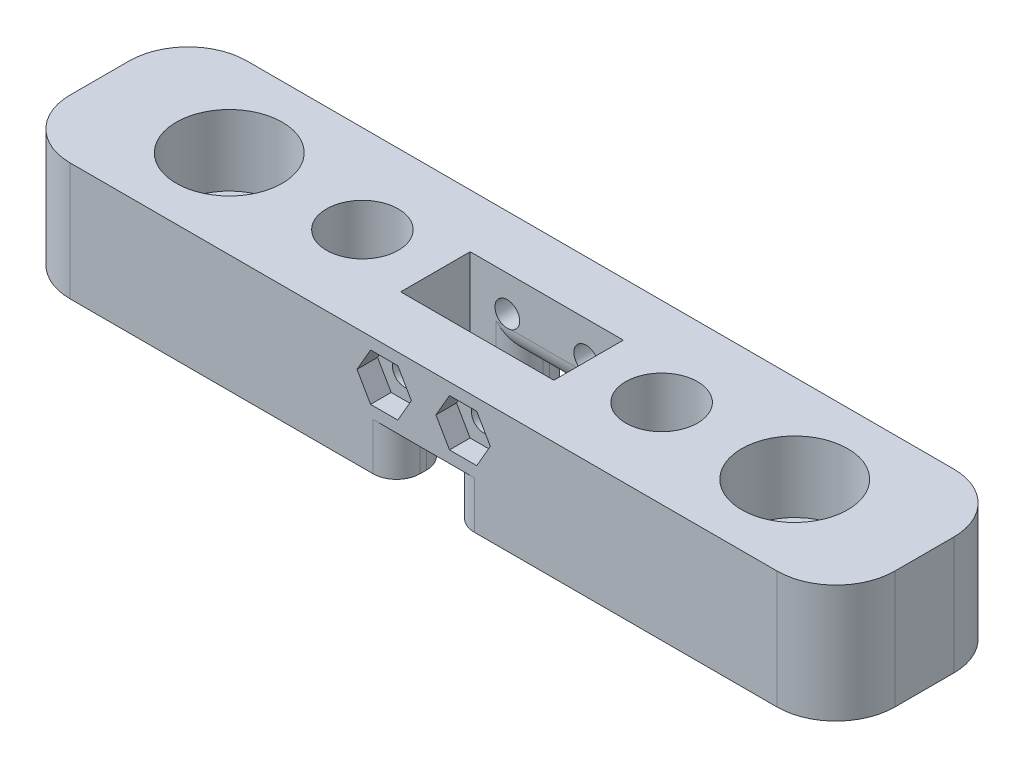
from build123d import *

# Parameters (mm, degrees)
SKETCH1_W                = 40
SKETCH1_H                = 10
SWITCHCASE_DEPTH         = 15
SKETCH2_W                = 13
SKETCH2_H                = 5.9
SWITCHCAVITY_DEPTH       = 44.874821937
SWITCHM2HOLES_DEPTH      = 43.534721111
SWITCHM2HOLES_DEPTH_BACK = 43.534721111
SKETCH3_R                = 1.05
SKETCH14_R               = 2
M2HEAD_DEPTH             = 1.5
M2NUTINSERTS_DEPTH       = 44.874821937
M2NUTINSERTS_DEPTH_BACK  = 1.75
SKETCH7_W                = 15
SKETCH7_H                = 10
WINGS_DEPTH              = 15
M5NUTS_DEPTH             = 4
SKETCH10_R               = 3.05
M6HOLE_DEPTH             = 58.879184514
WIRECHANNEL_DEPTH        = 57.870049235
WIRECHANNEL_DEPTH_BACK   = 57.870049235
SKETCH11_W               = 4.6
SKETCH11_H               = 4
CHANNELFILLET_R          = 2
M5HEAD_DEPTH             = 58.879184514
M5HEAD_DEPTH_BACK        = 6
SKETCH12_R               = 4.5
SKETCH13_R               = 2.75
M5THREAD_DEPTH           = 58.879184514
ENDFILLET_R              = 5


with BuildPart() as part:
    # Sketch1 → SwitchCase (new body)
    with BuildSketch(Plane.XY):
        with Locations((20, 5)):
            Rectangle(SKETCH1_W, SKETCH1_H)
    extrude(amount=SWITCHCASE_DEPTH)

    # Sketch2 → SwitchCavity (cut, through all)
    with BuildSketch(Plane(origin=(0, 10, 0), x_dir=(1, 0, 0), z_dir=(0, 1, 0))):
        with Locations((20, -7.5)):
            Rectangle(SKETCH2_W, SKETCH2_H)
    extrude(amount=-SWITCHCAVITY_DEPTH, mode=Mode.SUBTRACT)

    # Sketch3 → SwitchM2Holes (cut, two sides: drawn at the far end of the back side and taken through both)
    with BuildSketch(Plane.XY.offset(4.55).offset(-SWITCHM2HOLES_DEPTH_BACK)):
        with Locations((16.65, 7)):
            Circle(SKETCH3_R)
        with Locations((23.35, 7)):
            Circle(SKETCH3_R)
    extrude(amount=SWITCHM2HOLES_DEPTH + SWITCHM2HOLES_DEPTH_BACK, mode=Mode.SUBTRACT)

    # Sketch14 → M2Head (cut)
    with BuildSketch(Plane(origin=(0, 0, 0), x_dir=(-1, 0, 0), z_dir=(0, 0, -1))):
        with Locations((-23.35, 7)):
            Circle(SKETCH14_R)
        with Locations(Location((-16.65, 7, 0), (0, 0, 180))):
            Circle(SKETCH14_R)
    extrude(amount=-M2HEAD_DEPTH, mode=Mode.SUBTRACT)

    # Sketch5 → M2NutInserts (cut, two sides: drawn at the far end of the back side and taken through both)
    with BuildSketch(Plane.XY.offset(15).offset(-M2NUTINSERTS_DEPTH_BACK)):
        Polygon((18.959401077, 7), (17.804700538, 9), (15.495299462, 9), (14.340598923, 7), (15.495299462, 5), (17.804700538, 5), align=None)
        Polygon((25.659401077, 7), (24.504700538, 9), (22.195299462, 9), (21.040598923, 7), (22.195299462, 5), (24.504700538, 5), align=None)
    extrude(amount=M2NUTINSERTS_DEPTH + M2NUTINSERTS_DEPTH_BACK, mode=Mode.SUBTRACT)

    # Sketch7 → Wings (add)
    with BuildSketch(Plane.XY.offset(15)):
        with Locations((-7.5, 5)):
            Rectangle(SKETCH7_W, SKETCH7_H)
        with Locations((47.5, 5)):
            Rectangle(SKETCH7_W, SKETCH7_H)
    extrude(amount=-WINGS_DEPTH)

    # Sketch9 → M5Nuts (cut)
    with BuildSketch(Plane.XZ):
        Polygon((37.232199613, 7.5), (34.966099807, 11.425), (30.433900193, 11.425), (28.167800387, 7.5), (30.433900193, 3.575), (34.966099807, 3.575), align=None)
        Polygon((5.033900193, 3.575), (2.767800387, 7.5), (5.033900193, 11.425), (9.566099807, 11.425), (11.832199613, 7.5), (9.566099807, 3.575), align=None)
    extrude(amount=-M5NUTS_DEPTH, mode=Mode.SUBTRACT)

    # Sketch10 → M6Hole (cut, through all)
    with BuildSketch(Plane.XZ):
        with Locations(Location((7.3, 7.5, 0), (0, 0, 270))):
            Circle(SKETCH10_R)
        with Locations(Location((32.7, 7.5, 0), (0, 0, 270))):
            Circle(SKETCH10_R)
    extrude(amount=-M6HOLE_DEPTH, mode=Mode.SUBTRACT)

    # Sketch11 → WireChannel (cut, two sides: drawn at the far end of the back side and taken through both)
    with BuildSketch(Plane.XY.offset(4.55).offset(-WIRECHANNEL_DEPTH_BACK)):
        with Locations((20, 2)):
            Rectangle(SKETCH11_W, SKETCH11_H)
    extrude(amount=WIRECHANNEL_DEPTH + WIRECHANNEL_DEPTH_BACK, mode=Mode.SUBTRACT)

    # ChannelFillet
    # the kernel refuses this fillet: 2 mm, written as the material it takes off along each edge
    with BuildSketch(Plane(origin=(22.3, 4, 10.45), x_dir=(0, 1, 0), z_dir=(-1, 0, 0)), Plane(origin=(17.7, 4, 4.55), x_dir=(0, 1, 0), z_dir=(1, 0, 0))) as channelfillet_piece_1:
        with BuildLine():
            CenterArc((CHANNELFILLET_R, -CHANNELFILLET_R), CHANNELFILLET_R, 90, 90)
            Line((0, -CHANNELFILLET_R), (-CHANNELFILLET_R * 0.02, -CHANNELFILLET_R))
            Line((-CHANNELFILLET_R * 0.02, -CHANNELFILLET_R), (-CHANNELFILLET_R * 0.02, CHANNELFILLET_R * 0.02))
            Line((-CHANNELFILLET_R * 0.02, CHANNELFILLET_R * 0.02), (CHANNELFILLET_R, CHANNELFILLET_R * 0.02))
            Line((CHANNELFILLET_R, CHANNELFILLET_R * 0.02), (CHANNELFILLET_R, 0))
        make_face()
    extrude(amount=4.6, mode=Mode.SUBTRACT)
    with BuildSketch(Plane(origin=(17.7, 4, 10.45), x_dir=(-1, 0, 0), z_dir=(0, -1, 0)), Plane(origin=(22.3, 0, 10.45), x_dir=(1, 0, 0), z_dir=(0, 1, 0)), Plane(origin=(22.3, 4, 4.55), x_dir=(1, 0, 0), z_dir=(0, -1, 0)), Plane(origin=(22.3, 4, 15), x_dir=(1, 0, 0), z_dir=(0, -1, 0))) as channelfillet_piece_2:
        with BuildLine():
            CenterArc((CHANNELFILLET_R, -CHANNELFILLET_R), CHANNELFILLET_R, 90, 90)
            Line((0, -CHANNELFILLET_R), (-CHANNELFILLET_R * 0.02, -CHANNELFILLET_R))
            Line((-CHANNELFILLET_R * 0.02, -CHANNELFILLET_R), (-CHANNELFILLET_R * 0.02, CHANNELFILLET_R * 0.02))
            Line((-CHANNELFILLET_R * 0.02, CHANNELFILLET_R * 0.02), (CHANNELFILLET_R, CHANNELFILLET_R * 0.02))
            Line((CHANNELFILLET_R, CHANNELFILLET_R * 0.02), (CHANNELFILLET_R, 0))
        make_face()
    extrude(amount=4, mode=Mode.SUBTRACT)
    with BuildSketch(Plane(origin=(22.3, 4, 0), x_dir=(1, 0, 0), z_dir=(0, -1, 0)), Plane(origin=(17.7, 0, 4.55), x_dir=(0, 0, -1), z_dir=(0, 1, 0)), Plane(origin=(17.7, 0, 0), x_dir=(-1, 0, 0), z_dir=(0, 1, 0)), Plane(origin=(17.7, 0, 15), x_dir=(0, 0, -1), z_dir=(0, 1, 0))) as channelfillet_piece_3:
        with BuildLine():
            CenterArc((CHANNELFILLET_R, CHANNELFILLET_R), CHANNELFILLET_R, 180, 90)
            Line((0, CHANNELFILLET_R), (-CHANNELFILLET_R * 0.02, CHANNELFILLET_R))
            Line((-CHANNELFILLET_R * 0.02, CHANNELFILLET_R), (-CHANNELFILLET_R * 0.02, -CHANNELFILLET_R * 0.02))
            Line((-CHANNELFILLET_R * 0.02, -CHANNELFILLET_R * 0.02), (CHANNELFILLET_R, -CHANNELFILLET_R * 0.02))
            Line((CHANNELFILLET_R, -CHANNELFILLET_R * 0.02), (CHANNELFILLET_R, 0))
        make_face()
    extrude(amount=4, mode=Mode.SUBTRACT)
    with BuildSketch(Plane(origin=(27.3, 4, 10.45), x_dir=(0, 1, 0), z_dir=(-1, 0, 0))) as channelfillet_piece_4a_section:
        with BuildLine():
            CenterArc((CHANNELFILLET_R, -CHANNELFILLET_R), CHANNELFILLET_R, 90, 90)
            Line((0, -CHANNELFILLET_R), (-CHANNELFILLET_R * 0.02, -CHANNELFILLET_R))
            Line((-CHANNELFILLET_R * 0.02, -CHANNELFILLET_R), (-CHANNELFILLET_R * 0.02, CHANNELFILLET_R * 0.02))
            Line((-CHANNELFILLET_R * 0.02, CHANNELFILLET_R * 0.02), (CHANNELFILLET_R, CHANNELFILLET_R * 0.02))
            Line((CHANNELFILLET_R, CHANNELFILLET_R * 0.02), (CHANNELFILLET_R, 0))
        make_face()
    channelfillet_piece_4a = extrude(amount=9.6, mode=Mode.PRIVATE)
    channelfillet_piece_4a = split(channelfillet_piece_4a, bisect_by=Plane(origin=(22.3, 4.452790229, 10.902790229), z_dir=(1, 0, 0)), keep=Keep.TOP, mode=Mode.PRIVATE)
    with BuildSketch(Plane(origin=(22.3, 0, 10.45), x_dir=(1, 0, 0), z_dir=(0, 1, 0))) as channelfillet_piece_4b_section:
        with BuildLine():
            CenterArc((CHANNELFILLET_R, -CHANNELFILLET_R), CHANNELFILLET_R, 90, 90)
            Line((0, -CHANNELFILLET_R), (-CHANNELFILLET_R * 0.02, -CHANNELFILLET_R))
            Line((-CHANNELFILLET_R * 0.02, -CHANNELFILLET_R), (-CHANNELFILLET_R * 0.02, CHANNELFILLET_R * 0.02))
            Line((-CHANNELFILLET_R * 0.02, CHANNELFILLET_R * 0.02), (CHANNELFILLET_R, CHANNELFILLET_R * 0.02))
            Line((CHANNELFILLET_R, CHANNELFILLET_R * 0.02), (CHANNELFILLET_R, 0))
        make_face()
    channelfillet_piece_4b = extrude(amount=9, mode=Mode.PRIVATE)
    channelfillet_piece_4b = split(channelfillet_piece_4b, bisect_by=Plane(origin=(22.752790229, 4, 10.902790229), z_dir=(0, 1, 0)), keep=Keep.TOP, mode=Mode.PRIVATE)
    channelfillet_piece_4 = channelfillet_piece_4a & channelfillet_piece_4b
    add(channelfillet_piece_4, mode=Mode.SUBTRACT)
    with BuildSketch(Plane(origin=(17.7, 9, 10.45), x_dir=(-1, 0, 0), z_dir=(0, -1, 0))) as channelfillet_piece_5a_section:
        with BuildLine():
            CenterArc((CHANNELFILLET_R, -CHANNELFILLET_R), CHANNELFILLET_R, 90, 90)
            Line((0, -CHANNELFILLET_R), (-CHANNELFILLET_R * 0.02, -CHANNELFILLET_R))
            Line((-CHANNELFILLET_R * 0.02, -CHANNELFILLET_R), (-CHANNELFILLET_R * 0.02, CHANNELFILLET_R * 0.02))
            Line((-CHANNELFILLET_R * 0.02, CHANNELFILLET_R * 0.02), (CHANNELFILLET_R, CHANNELFILLET_R * 0.02))
            Line((CHANNELFILLET_R, CHANNELFILLET_R * 0.02), (CHANNELFILLET_R, 0))
        make_face()
    channelfillet_piece_5a = extrude(amount=9, mode=Mode.PRIVATE)
    channelfillet_piece_5a = split(channelfillet_piece_5a, bisect_by=Plane(origin=(17.247209771, 4, 10.902790229), z_dir=(0, 1, 0)), keep=Keep.TOP, mode=Mode.PRIVATE)
    with BuildSketch(Plane(origin=(22.3, 4, 10.45), x_dir=(0, 1, 0), z_dir=(-1, 0, 0))) as channelfillet_piece_5b_section:
        with BuildLine():
            CenterArc((CHANNELFILLET_R, -CHANNELFILLET_R), CHANNELFILLET_R, 90, 90)
            Line((0, -CHANNELFILLET_R), (-CHANNELFILLET_R * 0.02, -CHANNELFILLET_R))
            Line((-CHANNELFILLET_R * 0.02, -CHANNELFILLET_R), (-CHANNELFILLET_R * 0.02, CHANNELFILLET_R * 0.02))
            Line((-CHANNELFILLET_R * 0.02, CHANNELFILLET_R * 0.02), (CHANNELFILLET_R, CHANNELFILLET_R * 0.02))
            Line((CHANNELFILLET_R, CHANNELFILLET_R * 0.02), (CHANNELFILLET_R, 0))
        make_face()
    channelfillet_piece_5b = extrude(amount=9.6, mode=Mode.PRIVATE)
    channelfillet_piece_5b = split(channelfillet_piece_5b, bisect_by=Plane(origin=(17.7, 4.452790229, 10.902790229), z_dir=(-1, 0, 0)), keep=Keep.TOP, mode=Mode.PRIVATE)
    channelfillet_piece_5 = channelfillet_piece_5a & channelfillet_piece_5b
    add(channelfillet_piece_5, mode=Mode.SUBTRACT)
    with BuildSketch(Plane(origin=(22.3, 9, 4.55), x_dir=(1, 0, 0), z_dir=(0, -1, 0))) as channelfillet_piece_6a_section:
        with BuildLine():
            CenterArc((CHANNELFILLET_R, -CHANNELFILLET_R), CHANNELFILLET_R, 90, 90)
            Line((0, -CHANNELFILLET_R), (-CHANNELFILLET_R * 0.02, -CHANNELFILLET_R))
            Line((-CHANNELFILLET_R * 0.02, -CHANNELFILLET_R), (-CHANNELFILLET_R * 0.02, CHANNELFILLET_R * 0.02))
            Line((-CHANNELFILLET_R * 0.02, CHANNELFILLET_R * 0.02), (CHANNELFILLET_R, CHANNELFILLET_R * 0.02))
            Line((CHANNELFILLET_R, CHANNELFILLET_R * 0.02), (CHANNELFILLET_R, 0))
        make_face()
    channelfillet_piece_6a = extrude(amount=9, mode=Mode.PRIVATE)
    channelfillet_piece_6a = split(channelfillet_piece_6a, bisect_by=Plane(origin=(22.752790229, 4, 4.097209771), z_dir=(0, 1, 0)), keep=Keep.TOP, mode=Mode.PRIVATE)
    with BuildSketch(Plane(origin=(17.7, 4, 4.55), x_dir=(0, 1, 0), z_dir=(1, 0, 0))) as channelfillet_piece_6b_section:
        with BuildLine():
            CenterArc((CHANNELFILLET_R, -CHANNELFILLET_R), CHANNELFILLET_R, 90, 90)
            Line((0, -CHANNELFILLET_R), (-CHANNELFILLET_R * 0.02, -CHANNELFILLET_R))
            Line((-CHANNELFILLET_R * 0.02, -CHANNELFILLET_R), (-CHANNELFILLET_R * 0.02, CHANNELFILLET_R * 0.02))
            Line((-CHANNELFILLET_R * 0.02, CHANNELFILLET_R * 0.02), (CHANNELFILLET_R, CHANNELFILLET_R * 0.02))
            Line((CHANNELFILLET_R, CHANNELFILLET_R * 0.02), (CHANNELFILLET_R, 0))
        make_face()
    channelfillet_piece_6b = extrude(amount=9.6, mode=Mode.PRIVATE)
    channelfillet_piece_6b = split(channelfillet_piece_6b, bisect_by=Plane(origin=(22.3, 4.452790229, 4.097209771), z_dir=(1, 0, 0)), keep=Keep.TOP, mode=Mode.PRIVATE)
    channelfillet_piece_6 = channelfillet_piece_6a & channelfillet_piece_6b
    add(channelfillet_piece_6, mode=Mode.SUBTRACT)
    with BuildSketch(Plane(origin=(17.7, 0, 4.55), x_dir=(0, 0, -1), z_dir=(0, 1, 0))) as channelfillet_piece_7a_section:
        with BuildLine():
            CenterArc((CHANNELFILLET_R, CHANNELFILLET_R), CHANNELFILLET_R, 180, 90)
            Line((0, CHANNELFILLET_R), (-CHANNELFILLET_R * 0.02, CHANNELFILLET_R))
            Line((-CHANNELFILLET_R * 0.02, CHANNELFILLET_R), (-CHANNELFILLET_R * 0.02, -CHANNELFILLET_R * 0.02))
            Line((-CHANNELFILLET_R * 0.02, -CHANNELFILLET_R * 0.02), (CHANNELFILLET_R, -CHANNELFILLET_R * 0.02))
            Line((CHANNELFILLET_R, -CHANNELFILLET_R * 0.02), (CHANNELFILLET_R, 0))
        make_face()
    channelfillet_piece_7a = extrude(amount=9, mode=Mode.PRIVATE)
    channelfillet_piece_7a = split(channelfillet_piece_7a, bisect_by=Plane(origin=(17.247209771, 4, 4.097209771), z_dir=(0, 1, 0)), keep=Keep.TOP, mode=Mode.PRIVATE)
    with BuildSketch(Plane(origin=(12.7, 4, 4.55), x_dir=(0, 1, 0), z_dir=(1, 0, 0))) as channelfillet_piece_7b_section:
        with BuildLine():
            CenterArc((CHANNELFILLET_R, -CHANNELFILLET_R), CHANNELFILLET_R, 90, 90)
            Line((0, -CHANNELFILLET_R), (-CHANNELFILLET_R * 0.02, -CHANNELFILLET_R))
            Line((-CHANNELFILLET_R * 0.02, -CHANNELFILLET_R), (-CHANNELFILLET_R * 0.02, CHANNELFILLET_R * 0.02))
            Line((-CHANNELFILLET_R * 0.02, CHANNELFILLET_R * 0.02), (CHANNELFILLET_R, CHANNELFILLET_R * 0.02))
            Line((CHANNELFILLET_R, CHANNELFILLET_R * 0.02), (CHANNELFILLET_R, 0))
        make_face()
    channelfillet_piece_7b = extrude(amount=9.6, mode=Mode.PRIVATE)
    channelfillet_piece_7b = split(channelfillet_piece_7b, bisect_by=Plane(origin=(17.7, 4.452790229, 4.097209771), z_dir=(-1, 0, 0)), keep=Keep.TOP, mode=Mode.PRIVATE)
    channelfillet_piece_7 = channelfillet_piece_7a & channelfillet_piece_7b
    add(channelfillet_piece_7, mode=Mode.SUBTRACT)

    # Sketch12 → M5Head (cut, two sides: drawn at the far end of the back side and taken through both)
    with BuildSketch(Plane(origin=(0, 10, 0), x_dir=(1, 0, 0), z_dir=(0, 1, 0)).offset(-M5HEAD_DEPTH_BACK)):
        with Locations(Location((44, -7.5, 0), (0, 0, 90))):
            Circle(SKETCH12_R)
        with Locations(Location((-4, -7.5, 0), (0, 0, 90))):
            Circle(SKETCH12_R)
    extrude(amount=M5HEAD_DEPTH + M5HEAD_DEPTH_BACK, mode=Mode.SUBTRACT)

    # Sketch13 → M5Thread (cut, through all)
    with BuildSketch(Plane(origin=(0, 10, 0), x_dir=(1, 0, 0), z_dir=(0, 1, 0))):
        with Locations(Location((44, -7.5, 0), (0, 0, 270))):
            Circle(SKETCH13_R)
        with Locations(Location((-4, -7.5, 0), (0, 0, 90))):
            Circle(SKETCH13_R)
    extrude(amount=-M5THREAD_DEPTH, mode=Mode.SUBTRACT)

    # EndFillet
    endfillet_edges = [part.edges().sort_by_distance(p)[0] for p in [
        (-15, 5, 15),
        (-15, 5, 0),
        (55, 5, 15),
        (55, 5, 0),
    ]]
    fillet(endfillet_edges, radius=ENDFILLET_R)


solid = part.part
